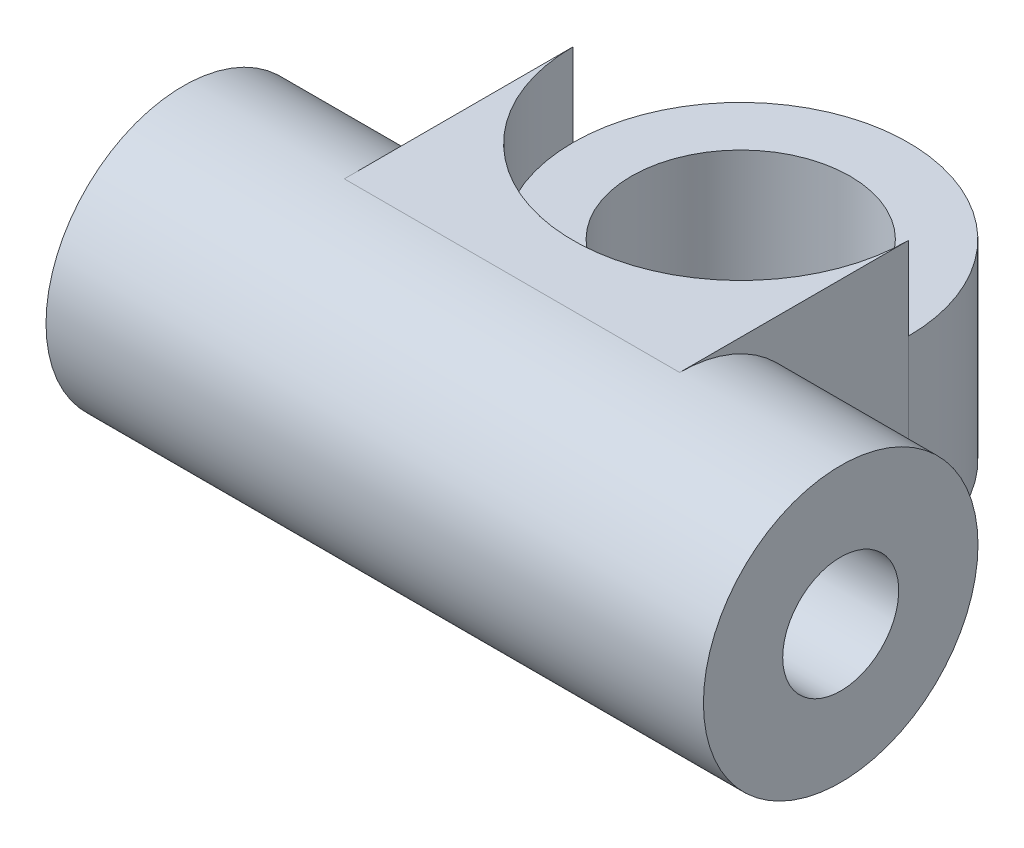
from build123d import *

# Parameters (mm, degrees)
SCHIZZO1_R                   = 2.485
ESTRUSIONE_ESTRUSIONE1_DEPTH = 11.9
ESTRUSIONE_ESTRUSIONE2_DEPTH = 2.485
SCHIZZO3_R                   = 1.98
TAGLIO_ESTRUSIONE1_DEPTH     = 15.757761517
SCHIZZO4_R                   = 1.05
TAGLIO_ESTRUSIONE2_DEPTH     = 15.116155638
SCHIZZO5_R                   = 3.035
TAGLIO_ESTRUSIONE3_DEPTH     = 1.5


with BuildPart() as part:
    # Schizzo1 → Estrusione-Estrusione1 (new body)
    with BuildSketch(Plane(origin=(0, 0, 0), x_dir=(0, 0, -1), z_dir=(1, 0, 0))):
        Circle(SCHIZZO1_R)
    extrude(amount=ESTRUSIONE_ESTRUSIONE1_DEPTH)

    # Schizzo2 → Estrusione-Estrusione2 (add, symmetric)
    with BuildSketch(Plane(origin=(0, 0, 0), x_dir=(1, 0, 0), z_dir=(0, 1, 0))):
        with BuildLine():
            Line((8.985, 0), (8.985, 4.14))
            ThreePointArc((8.985, 4.14), (5.95, 7.175), (2.915, 4.14))
            Line((2.915, 4.14), (2.915, 0))
            Line((2.915, 0), (8.985, 0))
        make_face()
    extrude(amount=ESTRUSIONE_ESTRUSIONE2_DEPTH, both=True)

    # Schizzo3 → Taglio-Estrusione1 (cut, through all)
    with BuildSketch(Plane(origin=(0, 2.485, 0), x_dir=(1, 0, 0), z_dir=(0, 1, 0))):
        with Locations((5.95, 4.14)):
            Circle(SCHIZZO3_R)
    extrude(amount=-TAGLIO_ESTRUSIONE1_DEPTH, mode=Mode.SUBTRACT)

    # Schizzo4 → Taglio-Estrusione2 (cut, through all)
    with BuildSketch(Plane.ZY):
        Circle(SCHIZZO4_R)
    extrude(amount=-TAGLIO_ESTRUSIONE2_DEPTH, mode=Mode.SUBTRACT)

    # Schizzo5 → Taglio-Estrusione3 (cut)
    with BuildSketch(Plane(origin=(0, 2.485, 0), x_dir=(1, 0, 0), z_dir=(0, 1, 0))):
        with Locations((5.95, 4.14)):
            Circle(SCHIZZO5_R)
    extrude(amount=-TAGLIO_ESTRUSIONE3_DEPTH, mode=Mode.SUBTRACT)


solid = part.part
